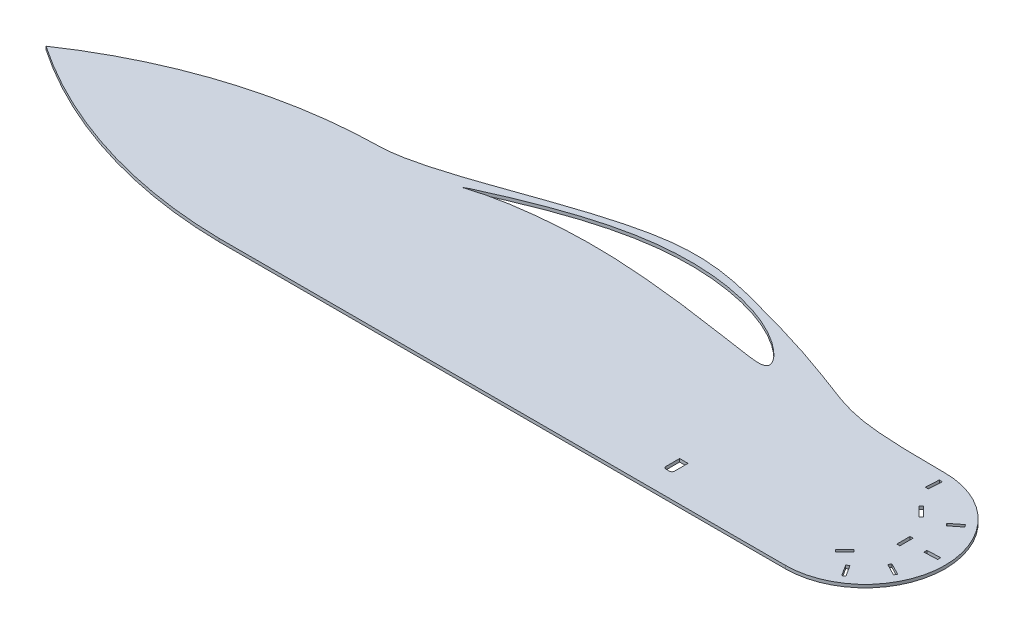
from build123d import *

# Parameters (mm, degrees)
BOSS_EXTRUDE1_DEPTH = 3
SKETCH2_W           = 3
SKETCH2_H           = 13
CUT_EXTRUDE1_DEPTH  = 905.889025332


with BuildPart() as part:
    # Sketch1 → Boss-Extrude1 (new body)
    with BuildSketch(Plane(origin=(0, 0, 0), x_dir=(1, 0, 0), z_dir=(0, 1, 0))):
        with BuildLine():
            Line((247.069884649, 0), (800, 0))
            ThreePointArc((800, 0), (878, 78), (800, 156))
            add(Edge.make_bspline(
                [(800, 156), (666.906858376, 156), (724.452667371, 168.817113245), (449.271793356, 236.202065707), (302.021810015, 156.797214814), (247.069884649, 156)],
                knots=[0, 0, 0, 0, 0.676894035, 0.776894035, 1, 1, 1, 1], degree=3))
            ThreePointArc((247.069884649, 156), (117.814256938, 135.120629211), (0, 78))
            ThreePointArc((0, 78), (117.814256938, 20.879370789), (247.069884649, 0))
        make_face()
    extrude(amount=BOSS_EXTRUDE1_DEPTH)

    # Sketch2 → Cut-Extrude1 (cut, through all)
    with BuildSketch(Plane.XZ):
        Polygon((824.350630807, -106.217429412), (815.158242652, -115.409817568), (817.279562995, -117.531137911), (826.471951151, -108.338749756), align=None)
        Polygon((831.784667602, -31.281640064), (838.809340828, -20.342994533), (836.285038013, -18.721916096), (829.260364787, -29.660561627), align=None)
        with Locations((837.956436587, -78.816857662)):
            Rectangle(SKETCH2_W, SKETCH2_H)
        with BuildLine():
            Line((322.885752953, -161.836658289), (322.885752953, -161.869658289))
            add(Edge.make_bspline(
                [(322.885752953, -161.869658289), (323.130890766, -162.034978178), (324.037236907, -162.646214123), (325.979932557, -163.795502857), (329.039190401, -165.352777833), (333.099517997, -167.155306141), (338.074836772, -169.355628947), (343.98890484, -171.947818411), (353.650384578, -176.048840107), (364.387350108, -180.503435887), (376.127068585, -185.126262043), (385.875522557, -188.767491704), (396.136017108, -192.364525981), (410.528918114, -197.017769685), (425.363223713, -201.189304601), (440.532525717, -204.65311987), (452.032550978, -206.837669679), (463.554161106, -208.54542171), (475.065573662, -209.764703661), (486.53790761, -210.464193217), (497.927204419, -210.661761527), (509.169504339, -210.339531039), (523.737173949, -209.271217333), (537.89655545, -207.274918088), (551.511119524, -204.40233467), (561.137696068, -201.894611373), (570.264671009, -199.04457097), (578.827498501, -195.86252005), (586.76937789, -192.399614871), (594.030901099, -188.703735037), (600.563896722, -184.859709387), (606.335420514, -180.981821522), (611.313780348, -177.160623105), (615.463346501, -173.45896328), (618.763092425, -169.957604556), (621.167993084, -166.755717806), (622.546278602, -164.093870763), (622.988129676, -162.012909363), (622.681710057, -160.268855953), (621.152050906, -158.842823368), (618.616578625, -158.179433189), (615.306502446, -157.971776814), (611.160896772, -158.207755615), (606.202140787, -158.781881499), (600.443136288, -159.608641421), (593.916441486, -160.589029781), (586.661727789, -161.656847475), (578.734617633, -162.845739482), (570.185377473, -164.127833624), (557.719910012, -165.988883729), (544.61854065, -167.866858952), (523.546313221, -170.655182735), (505.232214523, -172.745398483), (482.728823591, -174.760044869), (463.59432983, -176.072276133), (444.419658433, -176.695383621), (429.153283072, -176.694176129), (417.88505192, -176.437943039), (406.860591972, -175.917261805), (396.169396169, -175.173490421), (385.902041861, -174.229464555), (376.1453267, -173.131806152), (366.989216993, -171.887700603), (358.520794637, -170.533420052), (350.825820477, -169.098178249), (343.981808961, -167.638953433), (338.051311686, -166.204447199), (333.087283396, -164.780461772), (329.090393675, -163.487509297), (326.040546819, -162.570117707), (324.06910994, -162.071603812), (323.131990199, -161.885546612), (322.885752953, -161.836658289)],
                knots=[0, 0, 0, 0, 0.001413477, 0.005226038, 0.010781091, 0.017815608, 0.026460951, 0.036790889, 0.048685593, 0.076639155, 0.092362872, 0.109003461, 0.126386903, 0.144339126, 0.181312719, 0.200023431, 0.218712626, 0.237261299, 0.255692478, 0.274037197, 0.292192583, 0.310132767, 0.327788163, 0.362001934, 0.378421226, 0.394286639, 0.40954344, 0.424114253, 0.43793778, 0.450941833, 0.463044023, 0.474154417, 0.484164575, 0.493023962, 0.500713088, 0.507125739, 0.512129705, 0.514904185, 0.517171427, 0.520261618, 0.5242453, 0.529497961, 0.536092185, 0.54406114, 0.553363127, 0.563904543, 0.575614949, 0.588420092, 0.60222661, 0.616944448, 0.648675826, 0.665501113, 0.718564132, 0.736789145, 0.773513212, 0.810244924, 0.828488569, 0.846493195, 0.864125178, 0.88124851, 0.897725282, 0.913415058, 0.928184346, 0.941897285, 0.954411455, 0.965602702, 0.975349728, 0.983575522, 0.990284579, 0.99543259, 0.998799869, 1, 1, 1, 1], degree=3))
        make_face()
        with BuildLine():
            Line((658.069884649, -25.47338103), (658.069884649, -38.67338103))
            Line((658.069884649, -38.67338103), (666.269884649, -38.67338103))
            Line((666.269884649, -38.67338103), (666.269884649, -25.47338103))
            ThreePointArc((666.269884649, -25.47338103), (665.537651602, -23.705614077), (663.769884649, -22.97338103))
            Line((663.769884649, -22.97338103), (660.569884649, -22.97338103))
            ThreePointArc((660.569884649, -22.97338103), (658.802117696, -23.705614077), (658.069884649, -25.47338103))
        make_face()
        Polygon((802.164751739, -134.464007116), (803.007458192, -147.43666474), (806.001148413, -147.24219402), (805.15844196, -134.269536396), align=None)
        Polygon((843.327624911, -114.271023824), (853.513851797, -122.348200424), (855.377815627, -119.997532681), (845.191588741, -111.920356081), align=None)
        Polygon((856.380357493, -81.758395758), (869.369951732, -82.278435666), (869.489960941, -79.280836995), (856.500366702, -78.760797088), align=None)
        Polygon((850.813297013, -53.284031552), (862.348647346, -47.289392889), (860.965269193, -44.627388966), (849.42991886, -50.622027629), align=None)
        Polygon((822.40880299, -44.734564453), (813.216414835, -35.542176297), (811.095094491, -37.663496641), (820.287482647, -46.855884796), align=None)
    extrude(amount=-CUT_EXTRUDE1_DEPTH, mode=Mode.SUBTRACT)


solid = part.part
